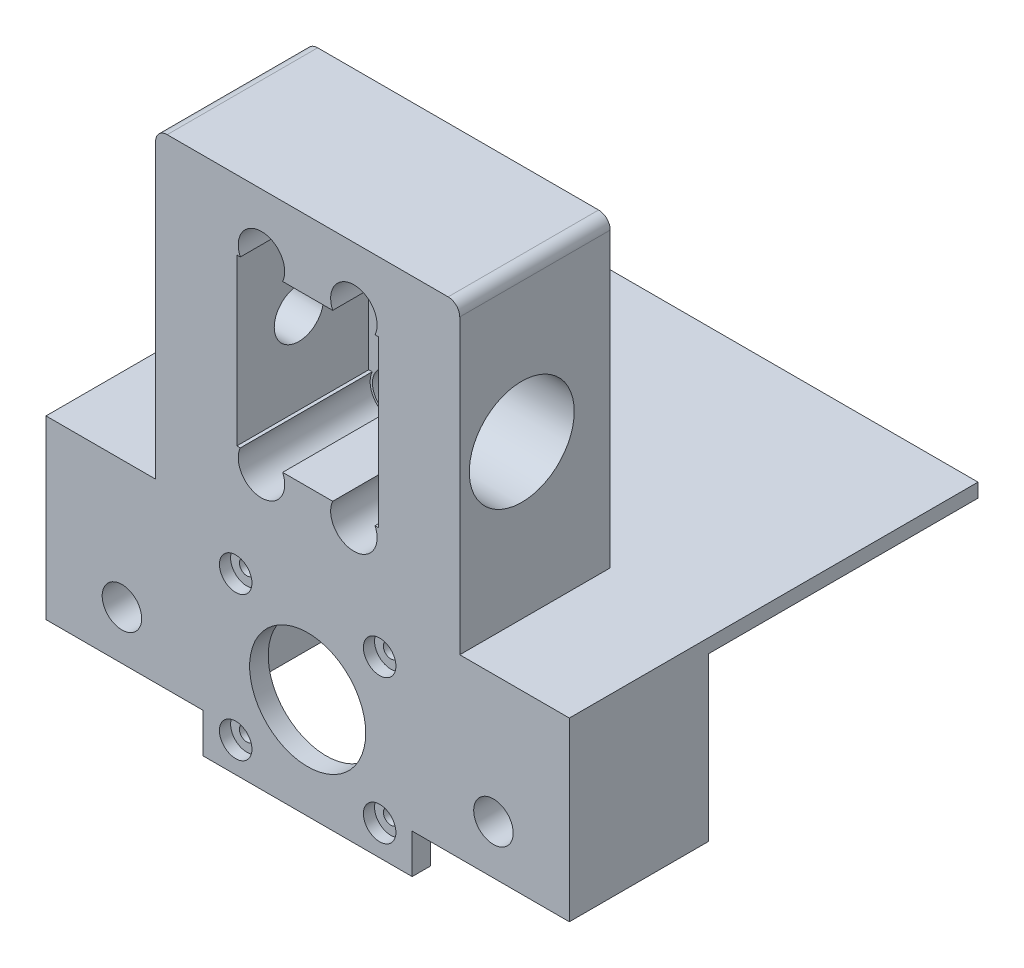
from build123d import *

# Parameters (mm, degrees)
BOSS_EXTRUDE1_DEPTH                              = 28.4
BOSS_EXTRUDE1_DEPTH_BACK                         = 4
SKETCH1_W                                        = 65.5
SKETCH1_H                                        = 65.5
SKETCH1_W_2                                      = 30.5
SKETCH1_H_2                                      = 35.6
CUT_EXTRUDE1_REACH                               = 98.887
SKETCH5_R                                        = 11.3
CUT_EXTRUDE4_REACH                               = 98.887
SKETCH7_R                                        = 5.3
SKETCH8_W                                        = 30.5
SKETCH8_H                                        = 35.6
BOSS_EXTRUDE2_DEPTH                              = 4
SKETCH9_R                                        = 4.9
CUT_EXTRUDE5_DEPTH                               = 2.2
FILLET1_R                                        = 2.5
CUT_EXTRUDE7_REACH                               = 98.887
SKETCH10_R                                       = 5
CBORE_FOR_M4_PAN_HEAD_MACHINE_SCREW1_D           = 4.8
CBORE_FOR_M4_PAN_HEAD_MACHINE_SCREW1_DEPTH       = 8
CBORE_FOR_M4_PAN_HEAD_MACHINE_SCREW1_CBORE_D     = 9
CBORE_FOR_M4_PAN_HEAD_MACHINE_SCREW1_CBORE_DEPTH = 3.1
CBORE_FOR_M4_PAN_HEAD_MACHINE_SCREW1_TIP         = 1.442065486
SKETCH23_W                                       = 112.7
SKETCH23_H                                       = 88
BOSS_EXTRUDE3_DEPTH                              = 3
SKETCH24_W                                       = 45
SKETCH24_H                                       = 4
BOSS_EXTRUDE4_DEPTH                              = 43.5
CBORE_FOR_M3_PAN_HEAD_MACHINE_SCREW1_D           = 3.2
CBORE_FOR_M3_PAN_HEAD_MACHINE_SCREW1_CBORE_D     = 7
CBORE_FOR_M3_PAN_HEAD_MACHINE_SCREW1_CBORE_DEPTH = 2.4
CUT_EXTRUDE8_REACH                               = 170.008
SKETCH28_R                                       = 12.5
SKETCH30_W                                       = 33.85
SKETCH30_H                                       = 30
BOSS_EXTRUDE5_DEPTH                              = 35
CUT_EXTRUDE10_REACH                              = 170.008
SKETCH31_R                                       = 4.25
CBORE_START                                      = -103.5
CBORE_FOR_M3_PAN_HEAD_MACHINE_SCREW2_OUT_R       = 3.5
CBORE_FOR_M3_PAN_HEAD_MACHINE_SCREW2_DEPTH       = 2.4
CBORE_START_2                                    = -101.1
CBORE_FOR_M3_PAN_HEAD_MACHINE_SCREW2_2_O_R       = 1.6
CBORE_FOR_M3_PAN_HEAD_MACHINE_SCREW2_2_DEPTH     = 4.162673424


# Read off the part's stored shape, not the designer's step: CBORE for M3 Pan Head Machine Screw2
with BuildPart() as part:
    # Sketch1 → Boss-Extrude1 (new, two sides: drawn at the far end of the back side and taken through both)
    with BuildSketch(Plane.XY.offset(-BOSS_EXTRUDE1_DEPTH_BACK)):
        with Locations((-32.75, -32.75)):
            Rectangle(SKETCH1_W, SKETCH1_H)
        with Locations((-32.75, -32.75)):
            Rectangle(SKETCH1_W_2, SKETCH1_H_2, mode=Mode.SUBTRACT)
    extrude(amount=BOSS_EXTRUDE1_DEPTH + BOSS_EXTRUDE1_DEPTH_BACK)

    # Sketch5 → Cut-Extrude1 (cut, up to next)
    with BuildSketch(Plane(origin=(0, 0, 0), x_dir=(0, 0, -1), z_dir=(1, 0, 0)), mode=Mode.PRIVATE) as cut_extrude1_sk1:
        with Locations((-15.05, -32.45)):
            Circle(SKETCH5_R)
    cut_extrude1_tool1 = extrude(cut_extrude1_sk1.sketch, amount=-CUT_EXTRUDE1_REACH, mode=Mode.PRIVATE) & part.part
    add(cut_extrude1_tool1.solids().sort_by_distance((0, -32.45, 15.05))[0], mode=Mode.SUBTRACT)

    # Sketch7 → Cut-Extrude4 (cut, up to next)
    with BuildSketch(Plane(origin=(-65.5, 0, 0), x_dir=(0, 0, -1), z_dir=(1, 0, 0)), mode=Mode.PRIVATE) as cut_extrude4_sk1:
        with Locations(Location((-15.05, -32.45, 0), (0, 0, 180))):
            Circle(SKETCH7_R)
    cut_extrude4_tool1 = extrude(cut_extrude4_sk1.sketch, amount=CUT_EXTRUDE4_REACH, mode=Mode.PRIVATE) & part.part
    add(cut_extrude4_tool1.solids().sort_by_distance((-65.5, -32.45, 15.05))[0], mode=Mode.SUBTRACT)

    # Sketch8 → Boss-Extrude2 (add)
    with BuildSketch(Plane(origin=(0, 0, -4), x_dir=(-1, 0, 0), z_dir=(0, 0, -1))):
        with Locations((32.75, -32.75)):
            Rectangle(SKETCH8_W, SKETCH8_H)
    extrude(amount=-BOSS_EXTRUDE2_DEPTH)

    # Sketch9 → Cut-Extrude5 (cut)
    with BuildSketch(Plane.XY.offset(-4)):
        with Locations((-12.75, -12.9)):
            Circle(SKETCH9_R)
        with Locations(Location((-52.75, -12.9, 0), (0, 0, 180))):
            Circle(SKETCH9_R)
        with Locations((-52.75, -52.6)):
            Circle(SKETCH9_R)
        with Locations(Location((-12.75, -52.6, 0), (0, 0, 180))):
            Circle(SKETCH9_R)
    extrude(amount=CUT_EXTRUDE5_DEPTH, mode=Mode.SUBTRACT)

    # Fillet1
    fillet1_edges = [part.edges().sort_by_distance(p)[0] for p in [
        (-65.5, 0, 12.2),
        (0, 0, 12.2),
    ]]
    fillet(fillet1_edges, radius=FILLET1_R)

    # Sketch10 → Cut-Extrude7 (cut, up to next)
    with BuildSketch(Plane.XY, mode=Mode.PRIVATE) as cut_extrude7_sk1:
        with Locations((-22.8, -12.9)):
            Circle(SKETCH10_R)
    cut_extrude7_tool1 = extrude(cut_extrude7_sk1.sketch, amount=CUT_EXTRUDE7_REACH, mode=Mode.PRIVATE) & part.part
    # Sketch10 → Cut-Extrude7 (cut, up to next)
    with BuildSketch(Plane.XY, mode=Mode.PRIVATE) as cut_extrude7_sk2:
        with Locations((-42.7, -12.9)):
            Circle(SKETCH10_R)
    cut_extrude7_tool2 = extrude(cut_extrude7_sk2.sketch, amount=CUT_EXTRUDE7_REACH, mode=Mode.PRIVATE) & part.part
    # Sketch10 → Cut-Extrude7 (cut, up to next)
    with BuildSketch(Plane.XY, mode=Mode.PRIVATE) as cut_extrude7_sk3:
        with Locations((-22.8, -52.6)):
            Circle(SKETCH10_R)
    cut_extrude7_tool3 = extrude(cut_extrude7_sk3.sketch, amount=CUT_EXTRUDE7_REACH, mode=Mode.PRIVATE) & part.part
    # Sketch10 → Cut-Extrude7 (cut, up to next)
    with BuildSketch(Plane.XY, mode=Mode.PRIVATE) as cut_extrude7_sk4:
        with Locations((-42.7, -52.6)):
            Circle(SKETCH10_R)
    cut_extrude7_tool4 = extrude(cut_extrude7_sk4.sketch, amount=CUT_EXTRUDE7_REACH, mode=Mode.PRIVATE) & part.part
    add(cut_extrude7_tool1.solids().sort_by_distance((-22.8, -12.9, 0))[0], mode=Mode.SUBTRACT)
    add(cut_extrude7_tool2.solids().sort_by_distance((-42.7, -12.9, 0))[0], mode=Mode.SUBTRACT)
    add(cut_extrude7_tool3.solids().sort_by_distance((-22.8, -52.6, 0))[0], mode=Mode.SUBTRACT)
    add(cut_extrude7_tool4.solids().sort_by_distance((-42.7, -52.6, 0))[0], mode=Mode.SUBTRACT)

    # CBORE for M4 Pan Head Machine Screw1
    with Locations(Plane(origin=(-42.7, -12.9, 0), x_dir=(1, 0, 0), z_dir=(0, 0, 1))):
        with Locations((0, 0), (19.9, 0), (0, -39.7), (19.9, -39.7)):
            CounterBoreHole(CBORE_FOR_M4_PAN_HEAD_MACHINE_SCREW1_D / 2, CBORE_FOR_M4_PAN_HEAD_MACHINE_SCREW1_CBORE_D / 2, CBORE_FOR_M4_PAN_HEAD_MACHINE_SCREW1_CBORE_DEPTH, depth=CBORE_FOR_M4_PAN_HEAD_MACHINE_SCREW1_DEPTH)
            with Locations((0, 0, -(CBORE_FOR_M4_PAN_HEAD_MACHINE_SCREW1_DEPTH + CBORE_FOR_M4_PAN_HEAD_MACHINE_SCREW1_TIP / 2))):  # 118° drill point
                Cone(0, CBORE_FOR_M4_PAN_HEAD_MACHINE_SCREW1_D / 2, CBORE_FOR_M4_PAN_HEAD_MACHINE_SCREW1_TIP, mode=Mode.SUBTRACT)

    # Sketch23 → Boss-Extrude3 (add)
    with BuildSketch(Plane.XZ.offset(65.5)):
        with Locations((-32.75, -15.6)):
            Rectangle(SKETCH23_W, SKETCH23_H)
    extrude(amount=BOSS_EXTRUDE3_DEPTH)

    # Sketch24 → Boss-Extrude4 (add)
    with BuildSketch(Plane(origin=(0, -68.5, 0), x_dir=(-1, 0, 0), z_dir=(0, -1, 0))):
        with Locations((32.75, -26.4)):
            Rectangle(SKETCH24_W, SKETCH24_H)
    extrude(amount=BOSS_EXTRUDE4_DEPTH)

    # CBORE for M3 Pan Head Machine Screw1 (through all)
    with Locations(Plane.XY.offset(28.4)):
        with Locations((-48.25, -74.5), (-48.25, -105.5)):
            cbore_for_m3_pan_head_machine_screw1 = CounterBoreHole(CBORE_FOR_M3_PAN_HEAD_MACHINE_SCREW1_D / 2, CBORE_FOR_M3_PAN_HEAD_MACHINE_SCREW1_CBORE_D / 2, CBORE_FOR_M3_PAN_HEAD_MACHINE_SCREW1_CBORE_DEPTH)

    # Sketch28 → Cut-Extrude8 (cut, up to next)
    with BuildSketch(Plane.XY.offset(28.4), mode=Mode.PRIVATE) as cut_extrude8_sk1:
        with Locations((-32.75, -90.25)):
            Circle(SKETCH28_R)
    cut_extrude8_tool1 = extrude(cut_extrude8_sk1.sketch, amount=-CUT_EXTRUDE8_REACH, mode=Mode.PRIVATE) & part.part
    add(cut_extrude8_tool1.solids().sort_by_distance((-32.75, -90.25, 28.4))[0], mode=Mode.SUBTRACT)

    # Mirror1: CBORE for M3 Pan Head Machine Screw1 across plane
    add(cbore_for_m3_pan_head_machine_screw1.mirror(Plane(origin=(-32.75, 0, 0), x_dir=(0, 0, 1), z_dir=(1, 0, 0))), mode=Mode.SUBTRACT)

    # Sketch30 → Boss-Extrude5 (add)
    with BuildSketch(Plane(origin=(0, -68.5, 0), x_dir=(-1, 0, 0), z_dir=(0, -1, 0))):
        with Locations((72.175, -13.4)):
            Rectangle(SKETCH30_W, SKETCH30_H)
    boss_extrude5 = extrude(amount=BOSS_EXTRUDE5_DEPTH)

    # Sketch31 → Cut-Extrude10 (cut, up to next)
    with BuildSketch(Plane.XY.offset(28.4), mode=Mode.PRIVATE) as cut_extrude10_sk1:
        with Locations((-72.75, -93)):
            Circle(SKETCH31_R)
    cut_extrude10_tool1 = extrude(cut_extrude10_sk1.sketch, amount=-CUT_EXTRUDE10_REACH, mode=Mode.PRIVATE) & part.part
    cut_extrude10 = cut_extrude10_tool1.solids().sort_by_distance((-72.75, -93, 28.4))[0]
    add(cut_extrude10, mode=Mode.SUBTRACT)

    # CBORE for M3 Pan Head Machine Screw2 out → CBORE for M3 Pan Head Machine Screw2 (cut)
    with BuildSketch(Plane(origin=(0, 0, 0), x_dir=(1, 0, 0), z_dir=(0, 1, 0)).offset(CBORE_START)):
        with Locations((-72.75, -13.4)):
            Circle(CBORE_FOR_M3_PAN_HEAD_MACHINE_SCREW2_OUT_R)
    cbore_for_m3_pan_head_machine_screw2 = extrude(amount=CBORE_FOR_M3_PAN_HEAD_MACHINE_SCREW2_DEPTH, mode=Mode.SUBTRACT)

    # CBORE for M3 Pan Head Machine Screw2 2 o → CBORE for M3 Pan Head Machine Screw2 2 (cut)
    with BuildSketch(Plane(origin=(0, 0, 0), x_dir=(1, 0, 0), z_dir=(0, 1, 0)).offset(CBORE_START_2)):
        with Locations((-72.75, -13.4)):
            Circle(CBORE_FOR_M3_PAN_HEAD_MACHINE_SCREW2_2_O_R)
    cbore_for_m3_pan_head_machine_screw2_2 = extrude(amount=CBORE_FOR_M3_PAN_HEAD_MACHINE_SCREW2_2_DEPTH, mode=Mode.SUBTRACT)

    # Mirror2: Boss-Extrude5, Cut-Extrude10, CBORE for M3 Pan Head Machine Screw2, CBORE for M3 Pan Head Machine Screw2 2 across plane
    add(boss_extrude5.mirror(Plane(origin=(-32.75, 0, 0), x_dir=(0, 0, 1), z_dir=(1, 0, 0))))
    add(cut_extrude10.mirror(Plane(origin=(-32.75, 0, 0), x_dir=(0, 0, 1), z_dir=(1, 0, 0))), mode=Mode.SUBTRACT)
    add(cbore_for_m3_pan_head_machine_screw2.mirror(Plane(origin=(-32.75, 0, 0), x_dir=(0, 0, 1), z_dir=(1, 0, 0))), mode=Mode.SUBTRACT)
    add(cbore_for_m3_pan_head_machine_screw2_2.mirror(Plane(origin=(-32.75, 0, 0), x_dir=(0, 0, 1), z_dir=(1, 0, 0))), mode=Mode.SUBTRACT)


solid = part.part
